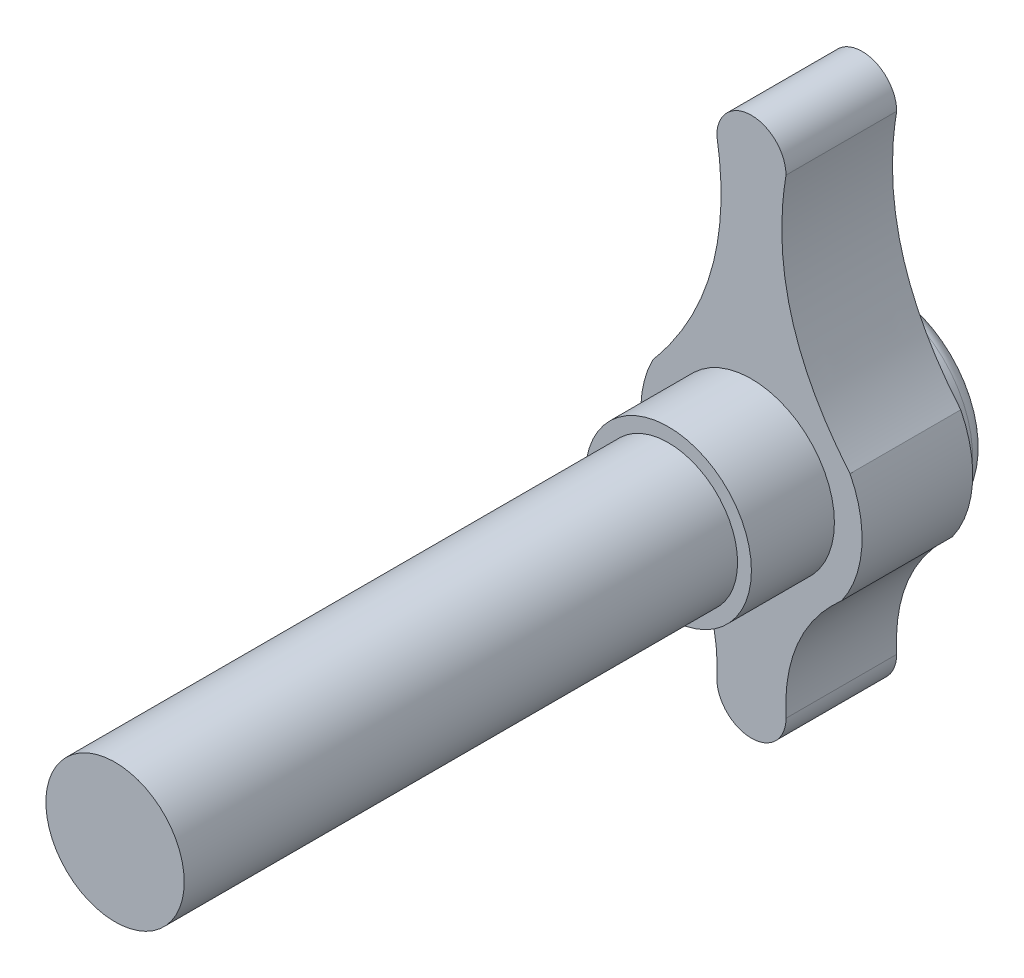
from build123d import *

# Parameters (mm, degrees)
EXTRUDE_1_DEPTH     = 4
SKETCH_2_R          = 3.489709511
EXTRUDE_2_DEPTH     = 1
SKETCH_3_R          = 2.151097983
CUT_EXTRUDE_1_DEPTH = 0.5
FILLET_1_R          = 0.5
FILLET_2_R          = 0.5
SKETCH_4_R          = 3
EXTRUDE_3_DEPTH     = 3
SKETCH_5_R          = 2.5
EXTRUDE_4_DEPTH     = 20


with BuildPart() as part:
    # 草图1 → 凸台-拉伸1 (new body)
    with BuildSketch(Plane.XY):
        with BuildLine():
            ThreePointArc((3.264818601, -2.311051601), (3.989491131, -0.289759403), (3.564498931, 1.815033712))
            add(Edge.make_bspline(
                [(3.564498931, 1.815033712), (0.483839944, 5.460493331), (1.25, 10)],
                knots=[0, 0, 0, 1, 1, 1], degree=2))
            ThreePointArc((1.25, 10), (0, 11.25), (-1.25, 10))
            add(Edge.make_bspline(
                [(-3.564498931, 1.815033712), (-0.483839944, 5.460493331), (-1.25, 10)],
                knots=[0, 0, 0, 1, 1, 1], degree=2))
            ThreePointArc((-3.564498931, 1.815033712), (-3.989491131, -0.289759403), (-3.264818601, -2.311051601))
            add(Edge.make_bspline(
                [(-3.264818601, -2.311051601), (-1.095834513, -4.228126611), (-1.25, -7)],
                knots=[0, 0, 0, 1, 1, 1], degree=2))
            ThreePointArc((-1.25, -7), (0, -8.25), (1.25, -7))
            add(Edge.make_bspline(
                [(3.264818601, -2.311051601), (1.095834513, -4.228126611), (1.25, -7)],
                knots=[0, 0, 0, 1, 1, 1], degree=2))
        make_face()
    extrude(amount=EXTRUDE_1_DEPTH)

    # 草图2 → 凸台-拉伸2 (add)
    with BuildSketch(Plane(origin=(0, 0, 0), x_dir=(-1, 0, 0), z_dir=(0, 0, -1))):
        with Locations((0, 0.098197479)):
            Circle(SKETCH_2_R)
    extrude(amount=EXTRUDE_2_DEPTH)

    # 草图3 → 切除-拉伸1 (cut)
    with BuildSketch(Plane(origin=(0, 0, -1), x_dir=(-1, 0, 0), z_dir=(0, 0, -1))):
        Circle(SKETCH_3_R)
    extrude(amount=-CUT_EXTRUDE_1_DEPTH, mode=Mode.SUBTRACT)

    # 圆角1
    fillet_1_edges = [part.edges().sort_by_distance(p)[0] for p in [
        (2.151097983, 0, -0.5),
    ]]
    fillet(fillet_1_edges, radius=FILLET_1_R - 0.0001)  # a hair under: the kernel refuses the full size

    # 圆角2
    fillet_2_edges = [part.edges().sort_by_distance(p)[0] for p in [
        (3.489709511, 0.098197479, -1),
    ]]
    fillet(fillet_2_edges, radius=FILLET_2_R)

    # 草图4 → 凸台-拉伸3 (add)
    with BuildSketch(Plane.XY.offset(4)):
        Circle(SKETCH_4_R)
    extrude(amount=EXTRUDE_3_DEPTH)

    # 草图5 → 凸台-拉伸4 (add)
    with BuildSketch(Plane.XY.offset(7)):
        Circle(SKETCH_5_R)
    extrude(amount=EXTRUDE_4_DEPTH)


solid = part.part
